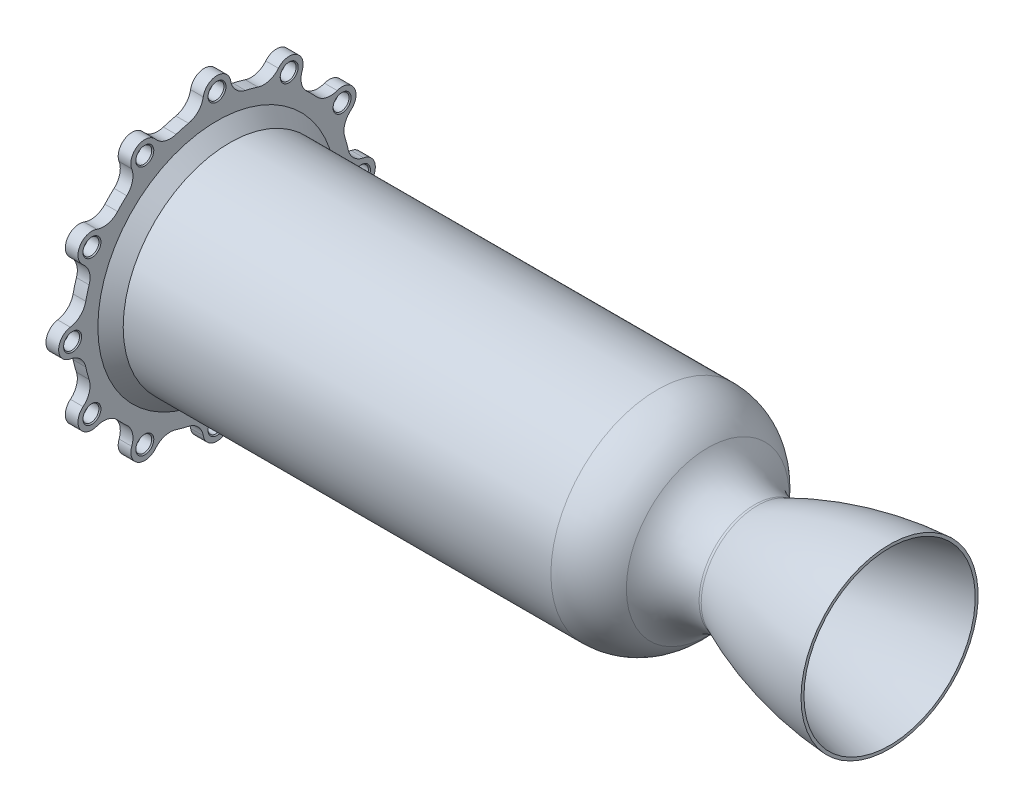
from build123d import *

# Parameters (mm, degrees)
CHAMFER1_SIZE      = 6.35
HOLE2_D            = 8
CIRPATTERN3_COUNT  = 12
CUT_EXTRUDE1_REACH = 363.375
CIRPATTERN4_COUNT  = 12
FILLET2_R          = 0.254
FILLET3_R          = 0.127
CUT_EXTRUDE2_START = -234.733065153
CUT_EXTRUDE2_DEPTH = 12.795068924
CIRPATTERN5_COUNT  = 26
CHAMFER2_SIZE      = 0.508


# Read off the part's stored shape, not the designer's step: Cut-Extrude2
with BuildPart() as part:
    # Sketch1 → Revolve1 (revolve)
    with BuildSketch(Plane.XY, mode=Mode.PRIVATE) as revolve1_sk:
        with BuildLine():
            Line((67.605732053, 44.399981539), (67.605732053, 42.924896029))
            add(Edge.make_bspline(
                [(3.699332053, 22.287076755), (3.920712381, 22.390304603), (4.345976212, 22.587493687), (5.42696462, 23.086580245), (6.28528486, 23.473631857), (7.738021551, 24.126454308), (8.992112303, 24.675947975), (10.384710427, 25.279484401), (11.701701818, 25.837381302), (12.793338351, 26.295269865), (14.135940427, 26.849765516), (15.764867401, 27.511372994), (17.66277086, 28.264713624), (19.844674271, 29.108343584), (22.031204136, 29.931269351), (24.226431998, 30.73585381), (26.427505675, 31.521219446), (28.635619951, 32.288372027), (31.288672744, 33.185713052), (34.506348053, 34.237672022), (37.73687979, 35.249222431), (40.979366994, 36.221743137), (43.786032373, 37.033687046), (46.035838806, 37.66704158), (48.290382754, 38.284554294), (50.548556832, 38.886309744), (52.811800296, 39.472911817), (55.077112518, 40.044024318), (57.065411708, 40.531369751), (58.767174946, 40.938968781), (60.194278759, 41.274230025), (61.322948971, 41.535921755), (62.481528548, 41.800252837), (63.586271631, 42.049457669), (64.792899359, 42.316666921), (65.803708358, 42.538638984), (66.875545366, 42.769110626), (67.366804544, 42.874113683), (67.605732053, 42.924896029)],
                knots=[0.082932585, 0.082932585, 0.082932585, 0.082932585, 0.082932585, 0.097450672, 0.111968759, 0.126486844, 0.141004929, 0.170041082, 0.184559169, 0.199077256, 0.213595339, 0.228113422, 0.257149585, 0.28618575, 0.315221915, 0.344258077, 0.373294238, 0.402330408, 0.431366568, 0.460402735, 0.51246758, 0.570539907, 0.599576074, 0.62861224, 0.657648405, 0.68668457, 0.715720735, 0.7447569, 0.773793065, 0.802829229, 0.817347312, 0.831865394, 0.846383476, 0.860901558, 0.87541964, 0.889937721, 0.904455803, 0.918973885, 0.918973885, 0.918973885, 0.918973885, 0.918973885], degree=4))
            ThreePointArc((3.699332053, 22.287076755), (1.885501224, 21.740048091), (0, 21.555365189))
            ThreePointArc((0, 21.555365189), (-16.471530776, 25.76531333), (-28.902915867, 37.362539472))
            ThreePointArc((-28.902915867, 37.362539472), (-38.997243823, 46.779527458), (-52.372184136, 50.19802))
            Line((-52.372184136, 50.19802), (-277.606684136, 50.19802))
            Line((-277.606684136, 50.19802), (-277.606684136, 53.37302))
            Line((-277.606684136, 53.37302), (-272.717184136, 53.37302))
            Line((-272.717184136, 53.37302), (-272.717184136, 59.72302))
            Line((-272.717184136, 59.72302), (-275.892184136, 59.72302))
            Line((-275.892184136, 59.72302), (-275.892184136, 62.8777))
            Line((-275.892184136, 62.8777), (-273.910984136, 62.8777))
            Line((-273.910984136, 62.8777), (-273.910984136, 65.9511))
            Line((-273.910984136, 65.9511), (-275.892184136, 65.9511))
            Line((-275.892184136, 65.9511), (-275.892184136, 79.375))
            Line((-275.892184136, 79.375), (-269.542184136, 79.375))
            Line((-269.542184136, 79.375), (-269.542184136, 53.37302))
            Line((-269.542184136, 53.37302), (-48.81204017, 53.37302))
            ThreePointArc((-48.81204017, 53.37302), (-34.703370767, 50.052634609), (-23.556389587, 40.788492877))
            ThreePointArc((-23.556389587, 40.788492877), (-13.424590025, 31.336547669), (0, 27.905365189))
            ThreePointArc((0, 27.905365189), (0.702771779, 27.979518545), (1.374590841, 28.19871262))
            ThreePointArc((1.374590841, 28.19871262), (33.756678416, 39.297841731), (67.605732053, 44.399981539))
        make_face()
    revolve(revolve1_sk.sketch.rotate(Axis((-236.474550185, 0, 0), (1, 0, 0)), 90), axis=Axis((-236.474550185, 0, 0), (1, 0, 0)))

    # Chamfer1
    chamfer1_edges = [part.edges().sort_by_distance(p)[0] for p in [
        (-269.542184136, 0, -53.37302),
    ]]
    chamfer(chamfer1_edges, length=CHAMFER1_SIZE)

    # Hole2 (through all)
    with Locations(Plane.ZY.offset(275.892184136)):
        with Locations((0, 72.39)):
            hole2 = Hole(HOLE2_D / 2)

    # CirPattern3: Hole2 ×12 about axis
    cirpattern3_axis = Axis((0, 0, 0), (1, 0, 0))
    for i in range(1, CIRPATTERN3_COUNT):
        add(hole2.rotate(cirpattern3_axis, i * 360 / CIRPATTERN3_COUNT), mode=Mode.SUBTRACT)

    # Sketch11 → Cut-Extrude1 (cut, up to next)
    with BuildSketch(Plane.ZY.offset(275.892184136), mode=Mode.PRIVATE) as cut_extrude1_sk1:
        with BuildLine():
            ThreePointArc((79.375, 0), (77.717548697, 4.517460557), (73.531778846, 6.891049707))
            ThreePointArc((73.531778846, 6.891049707), (68.521982999, 9.388428721), (65.780227273, 14.268770092))
            ThreePointArc((65.780227273, 14.268770092), (65.016467368, 17.421109926), (64.101732931, 20.532996256))
            ThreePointArc((64.101732931, 20.532996256), (64.035992356, 26.130373726), (67.12591332, 30.798065318))
            ThreePointArc((67.12591332, 30.798065318), (69.56410177, 34.946538746), (68.740766425, 39.6875))
            ThreePointArc((68.740766425, 39.6875), (76.670362462, 20.543761705), (79.375, 0))
        make_face()
    cut_extrude1_tool1 = extrude(cut_extrude1_sk1.sketch, amount=-CUT_EXTRUDE1_REACH, mode=Mode.PRIVATE) & part.part
    cut_extrude1 = cut_extrude1_tool1.solids().sort_by_distance((-275.892184, 19.117237, 71.346501))[0]
    add(cut_extrude1, mode=Mode.SUBTRACT)

    # CirPattern4: Cut-Extrude1 ×12 about axis
    cirpattern4_axis = Axis((0, 0, 0), (1, 0, 0))
    for i in range(1, CIRPATTERN4_COUNT):
        add(cut_extrude1.rotate(cirpattern4_axis, i * 360 / CIRPATTERN4_COUNT), mode=Mode.SUBTRACT)

    # Fillet2
    fillet2_edges = [part.edges().sort_by_distance(p)[0] for p in [
        (-273.910984136, 0, -65.9511),
        (-273.910984136, 0, -62.8777),
    ]]
    fillet(fillet2_edges, radius=FILLET2_R)

    # Fillet3
    fillet3_edges = [part.edges().sort_by_distance(p)[0] for p in [
        (-275.892184136, 0, -65.9511),
        (-275.892184136, 0, -62.8777),
    ]]
    fillet(fillet3_edges, radius=FILLET3_R)

    # Cut-Extrude2 outline → Cut-Extrude2 (cut)
    with BuildSketch(Plane(origin=(0, 0, 0), x_dir=(0.707106781186537, 0.707106781186558, 0), z_dir=(0.707106781186558, -0.707106781186537, 0)).offset(CUT_EXTRUDE2_START)):
        with BuildLine():
            add(Edge.make_bspline(
                [(-152.069807459, 1.5875), (-150.125524975, 1.5875), (-151.097666217, -0.79375), (-152.069807459, -3.175), (-153.0419487, -0.79375), (-154.014089942, 1.5875), (-152.069807459, 1.5875)],
                knots=[0, 0, 0, 2.094395102, 2.094395102, 4.188790205, 4.188790205, 6.283185307, 6.283185307, 6.283185307], degree=2, weights=[1, 0.5, 1, 0.5, 1, 0.5, 1]))
        make_face()
    cut_extrude2 = extrude(amount=CUT_EXTRUDE2_DEPTH, mode=Mode.SUBTRACT)

    # CirPattern5: Cut-Extrude2 ×26 about axis
    cirpattern5_axis = Axis((-277.606684136, 0, 0), (-1, 0, 0))
    for i in range(1, CIRPATTERN5_COUNT):
        add(cut_extrude2.rotate(cirpattern5_axis, i * 360 / CIRPATTERN5_COUNT), mode=Mode.SUBTRACT)

    # Chamfer2
    chamfer2_edges = [part.edges().sort_by_distance(p)[0] for p in [
        (-275.892184136, -4, 72.39),
        (-269.542184136, -4, 72.39),
        (-275.892184136, 32.730898385, 64.69157898),
        (-269.542184136, 32.730898385, 64.69157898),
        (-275.892184136, 60.69157898, 39.659101615),
        (-269.542184136, 60.69157898, 39.659101615),
        (-275.892184136, 72.39, 4),
        (-269.542184136, 72.39, 4),
        (-275.892184136, 64.69157898, -32.730898385),
        (-269.542184136, 64.69157898, -32.730898385),
        (-275.892184136, 39.659101615, -60.69157898),
        (-269.542184136, 39.659101615, -60.69157898),
        (-275.892184136, 4, -72.39),
        (-269.542184136, 4, -72.39),
        (-275.892184136, -32.730898385, -64.69157898),
        (-269.542184136, -32.730898385, -64.69157898),
        (-275.892184136, -60.69157898, -39.659101615),
        (-269.542184136, -60.69157898, -39.659101615),
        (-275.892184136, -72.39, -4),
        (-269.542184136, -72.39, -4),
        (-275.892184136, -64.69157898, 32.730898385),
        (-269.542184136, -64.69157898, 32.730898385),
        (-275.892184136, -39.659101615, 60.69157898),
        (-269.542184136, -39.659101615, 60.69157898),
    ]]
    chamfer(chamfer2_edges, length=CHAMFER2_SIZE)


solid = part.part
